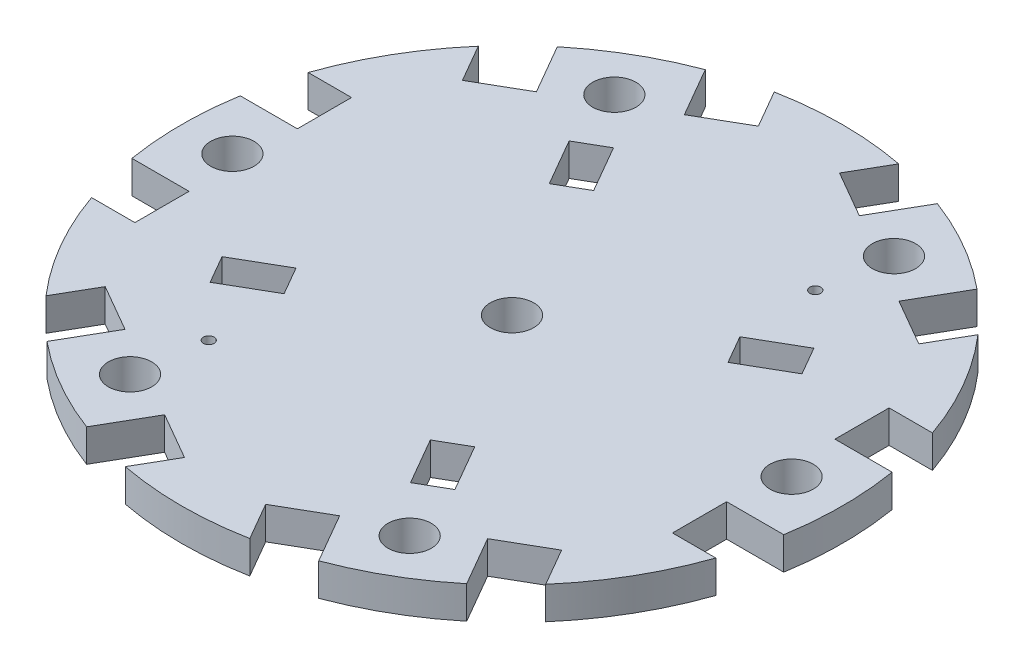
from build123d import *

# Parameters (mm, degrees)
CROQUIS1_R              = 30.5
SALIENTE_EXTRUIR1_DEPTH = 3
CROQUIS2_R              = 2
CORTAR_EXTRUIR1_DEPTH   = 4
CORTAR_EXTRUIR3_START   = -4
CORTAR_EXTRUIR3_DEPTH   = 4
CROQUIS7_R              = 2
CORTAR_EXTRUIR4_DEPTH   = 10
CROQUIS8_R              = 0.5
CORTAR_EXTRUIR5_DEPTH   = 3
CORTAR_EXTRUIR6_DEPTH   = 10


with BuildPart() as part:
    # Croquis1 → Saliente-Extruir1 (new body)
    with BuildSketch(Plane(origin=(0, 0, 0), x_dir=(1, 0, 0), z_dir=(0, 1, 0))):
        Circle(CROQUIS1_R)
    extrude(amount=SALIENTE_EXTRUIR1_DEPTH)

    # Croquis2 → Cortar-Extruir1 (cut)
    with BuildSketch(Plane(origin=(0, 3, 0), x_dir=(1, 0, 0), z_dir=(0, 1, 0))):
        Circle(CROQUIS2_R)
    extrude(amount=-CORTAR_EXTRUIR1_DEPTH, mode=Mode.SUBTRACT)

    # Croquis5 → Cortar-Extruir3 (cut)
    with BuildSketch(Plane(origin=(0, 3, 0), x_dir=(1, 0, 0), z_dir=(0, 1, 0)).offset(CORTAR_EXTRUIR3_START)):
        with BuildLine():
            Line((30.087372767, -5), (24.814059068, -5))
            Line((24.814059068, -5), (24.814059068, -10))
            Line((24.814059068, -10), (28.814059068, -10))
            ThreePointArc((28.814059068, -10), (29.556634924, -7.526973624), (30.087372767, -5))
        make_face()
        with BuildLine():
            ThreePointArc((19.373813402, -23.556429149), (21.296867835, -21.833309883), (23.067283572, -19.953707139))
            Line((23.067283572, -19.953707139), (21.067283572, -16.489605524))
            Line((21.067283572, -16.489605524), (16.737156553, -18.989605524))
            Line((16.737156553, -18.989605524), (19.373813402, -23.556429149))
        make_face()
        with BuildLine():
            Line((24.814059068, 5), (30.087372767, 5))
            ThreePointArc((30.087372767, 5), (29.556634924, 7.526973624), (28.814059068, 10))
            Line((28.814059068, 10), (24.814059068, 10))
            Line((24.814059068, 10), (24.814059068, 5))
        make_face()
        with BuildLine():
            ThreePointArc((5.746775496, -29.953707139), (8.25976709, -29.360283507), (10.713559364, -28.556429149))
            Line((10.713559364, -28.556429149), (8.076902515, -23.989605524))
            Line((8.076902515, -23.989605524), (3.746775496, -26.489605524))
            Line((3.746775496, -26.489605524), (5.746775496, -29.953707139))
        make_face()
        with BuildLine():
            Line((21.067283572, 16.489605524), (23.067283572, 19.953707139))
            ThreePointArc((23.067283572, 19.953707139), (21.296867835, 21.833309883), (19.373813402, 23.556429149))
            Line((19.373813402, 23.556429149), (16.737156553, 18.989605524))
            Line((16.737156553, 18.989605524), (21.067283572, 16.489605524))
        make_face()
        with BuildLine():
            ThreePointArc((-10.713559364, -28.556429149), (-8.25976709, -29.360283507), (-5.746775496, -29.953707139))
            Line((-5.746775496, -29.953707139), (-3.746775496, -26.489605524))
            Line((-3.746775496, -26.489605524), (-8.076902515, -23.989605524))
            Line((-8.076902515, -23.989605524), (-10.713559364, -28.556429149))
        make_face()
        with BuildLine():
            Line((8.076902515, 23.989605524), (10.713559364, 28.556429149))
            ThreePointArc((10.713559364, 28.556429149), (8.25976709, 29.360283507), (5.746775496, 29.953707139))
            Line((5.746775496, 29.953707139), (3.746775496, 26.489605524))
            Line((3.746775496, 26.489605524), (8.076902515, 23.989605524))
        make_face()
        with BuildLine():
            ThreePointArc((-23.067283572, -19.953707139), (-21.296867835, -21.833309883), (-19.373813402, -23.556429149))
            Line((-19.373813402, -23.556429149), (-16.737156553, -18.989605524))
            Line((-16.737156553, -18.989605524), (-21.067283572, -16.489605524))
            Line((-21.067283572, -16.489605524), (-23.067283572, -19.953707139))
        make_face()
        with BuildLine():
            Line((-3.746775496, 26.489605524), (-5.746775496, 29.953707139))
            ThreePointArc((-5.746775496, 29.953707139), (-8.25976709, 29.360283507), (-10.713559364, 28.556429149))
            Line((-10.713559364, 28.556429149), (-8.076902515, 23.989605524))
            Line((-8.076902515, 23.989605524), (-3.746775496, 26.489605524))
        make_face()
        with BuildLine():
            ThreePointArc((-30.087372767, -5), (-29.556634924, -7.526973624), (-28.814059068, -10))
            Line((-28.814059068, -10), (-24.814059068, -10))
            Line((-24.814059068, -10), (-24.814059068, -5))
            Line((-24.814059068, -5), (-30.087372767, -5))
        make_face()
        with BuildLine():
            Line((-16.737156553, 18.989605524), (-19.373813402, 23.556429149))
            ThreePointArc((-19.373813402, 23.556429149), (-21.296867835, 21.833309883), (-23.067283572, 19.953707139))
            Line((-23.067283572, 19.953707139), (-21.067283572, 16.489605524))
            Line((-21.067283572, 16.489605524), (-16.737156553, 18.989605524))
        make_face()
        with BuildLine():
            ThreePointArc((-28.814059068, 10), (-29.556634924, 7.526973624), (-30.087372767, 5))
            Line((-30.087372767, 5), (-24.814059068, 5))
            Line((-24.814059068, 5), (-24.814059068, 10))
            Line((-24.814059068, 10), (-28.814059068, 10))
        make_face()
    extrude(amount=CORTAR_EXTRUIR3_DEPTH, mode=Mode.SUBTRACT)

    # Croquis7 → Cortar-Extruir4 (cut)
    with BuildSketch(Plane(origin=(0, 3, 0), x_dir=(1, 0, 0), z_dir=(0, 1, 0))):
        with Locations((25.81405907, 0)):
            Circle(CROQUIS7_R)
        with Locations((12.907029535, 22.355630929)):
            Circle(CROQUIS7_R)
        with Locations((12.907029535, -22.355630929)):
            Circle(CROQUIS7_R)
        with Locations((-12.907029535, 22.355630929)):
            Circle(CROQUIS7_R)
        with Locations((-12.907029535, -22.355630929)):
            Circle(CROQUIS7_R)
        with Locations((-25.81405907, 0)):
            Circle(CROQUIS7_R)
    extrude(amount=-CORTAR_EXTRUIR4_DEPTH, mode=Mode.SUBTRACT)

    # Croquis8 → Cortar-Extruir5 (cut)
    with BuildSketch(Plane(origin=(0, 3, 0), x_dir=(1, 0, 0), z_dir=(0, 1, 0))):
        with Locations((12, 16)):
            Circle(CROQUIS8_R)
        with Locations((-12, -16)):
            Circle(CROQUIS8_R)
    extrude(amount=-CORTAR_EXTRUIR5_DEPTH, mode=Mode.SUBTRACT)

    # Croquis9 → Cortar-Extruir6 (cut)
    with BuildSketch(Plane(origin=(0, 3, 0), x_dir=(1, 0, 0), z_dir=(0, 1, 0))):
        Polygon((18.070508076, 8.700961894), (16.570508076, 11.299038106), (12.240381057, 8.799038106), (13.740381057, 6.200961894), align=None)
        Polygon((-8.799038106, 12.240381057), (-6.200961894, 13.740381057), (-8.700961894, 18.070508076), (-11.299038106, 16.570508076), align=None)
        Polygon((-12.240381057, -8.799038106), (-13.740381057, -6.200961894), (-18.070508076, -8.700961894), (-16.570508076, -11.299038106), align=None)
        Polygon((11.299038106, -16.570508076), (8.799038106, -12.240381057), (6.200961894, -13.740381057), (8.700961894, -18.070508076), align=None)
    extrude(amount=-CORTAR_EXTRUIR6_DEPTH, mode=Mode.SUBTRACT)


solid = part.part
